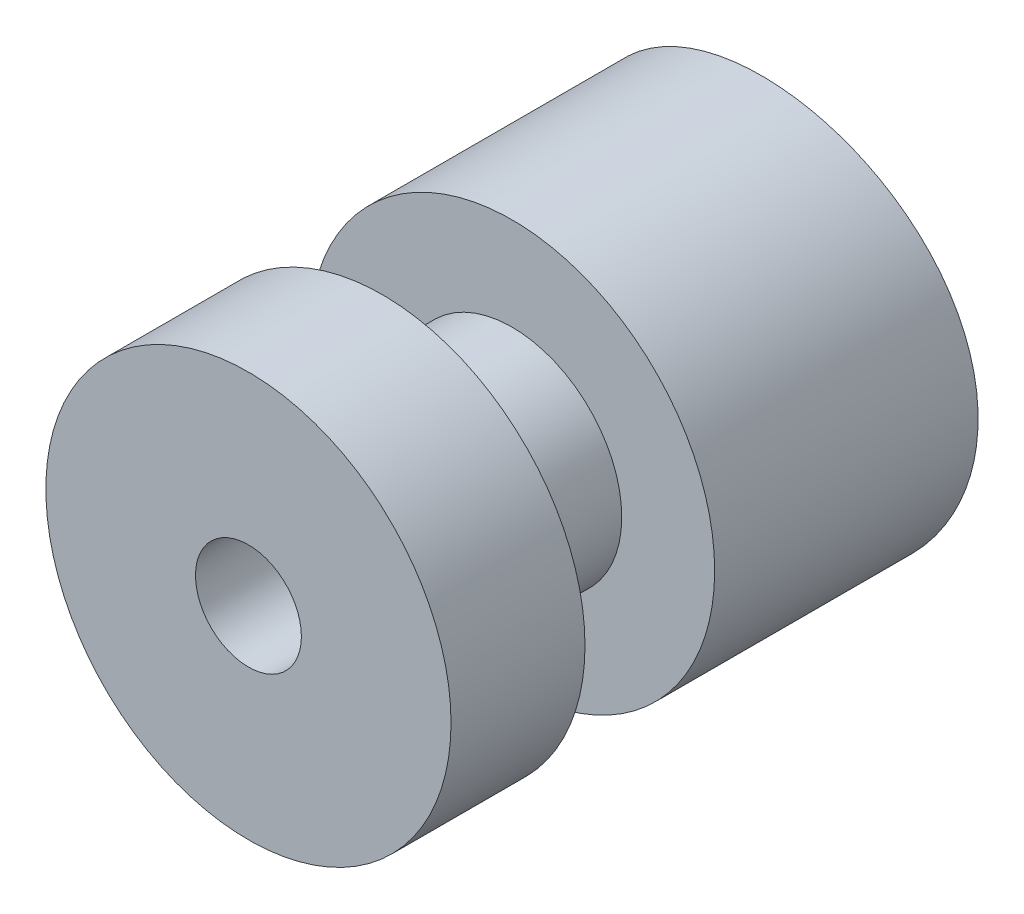
from build123d import *

# Parameters (mm, degrees)
SKETCH1_R              = 9.525
EXTRUDE1_DEPTH         = 24.78278
SKETCH2_OUTSIDE_W      = 28.372
SKETCH2_OUTSIDE_H      = 28.372
SKETCH2_OUTSIDE_R      = 5.1562
EXTRUDE2_DEPTH         = 6.096
EXTRUDE3_DEPTH         = 29.207045831
EXTRUDE3_DEPTH_BACK    = 29.207045831
F_10_CLEARANCE_HOLE1_D = 4.9784


with BuildPart() as part:
    # Sketch1 → Extrude1 (new body)
    with BuildSketch(Plane.XY):
        Circle(SKETCH1_R)
    extrude(amount=EXTRUDE1_DEPTH)

    # Sketch2 outside → Extrude2 (cut)
    with BuildSketch(Plane.XY.offset(18.48358)):
        Rectangle(SKETCH2_OUTSIDE_W, SKETCH2_OUTSIDE_H)
        Circle(SKETCH2_OUTSIDE_R, mode=Mode.SUBTRACT)
    extrude(amount=-EXTRUDE2_DEPTH, mode=Mode.SUBTRACT)

    # Sketch3 → Extrude3 (cut, two sides: drawn at the far end of the back side and taken through both)
    with BuildSketch(Plane(origin=(0, 0, 0), x_dir=(1, 0, 0), z_dir=(0, 1, 0)).offset(-EXTRUDE3_DEPTH_BACK)):
        with BuildLine():
            Line((81.364445057, 9.888659405), (9.525, 0))
            ThreePointArc((9.525, 0), (0, -0.652479271), (-9.525, 0))
            Line((-9.525, 0), (-81.364445057, 9.888659405))
            Line((-81.364445057, 9.888659405), (-81.364445057, 154.92233068))
            Line((-81.364445057, 154.92233068), (81.364445057, 154.92233068))
            Line((81.364445057, 154.92233068), (81.364445057, 9.888659405))
        make_face()
    extrude(amount=EXTRUDE3_DEPTH + EXTRUDE3_DEPTH_BACK, mode=Mode.SUBTRACT)

    # #10 Clearance Hole1 (through all)
    with Locations(Plane.XY.offset(24.78278)):
        with Locations((0, 0)):
            Hole(F_10_CLEARANCE_HOLE1_D / 2)


solid = part.part
